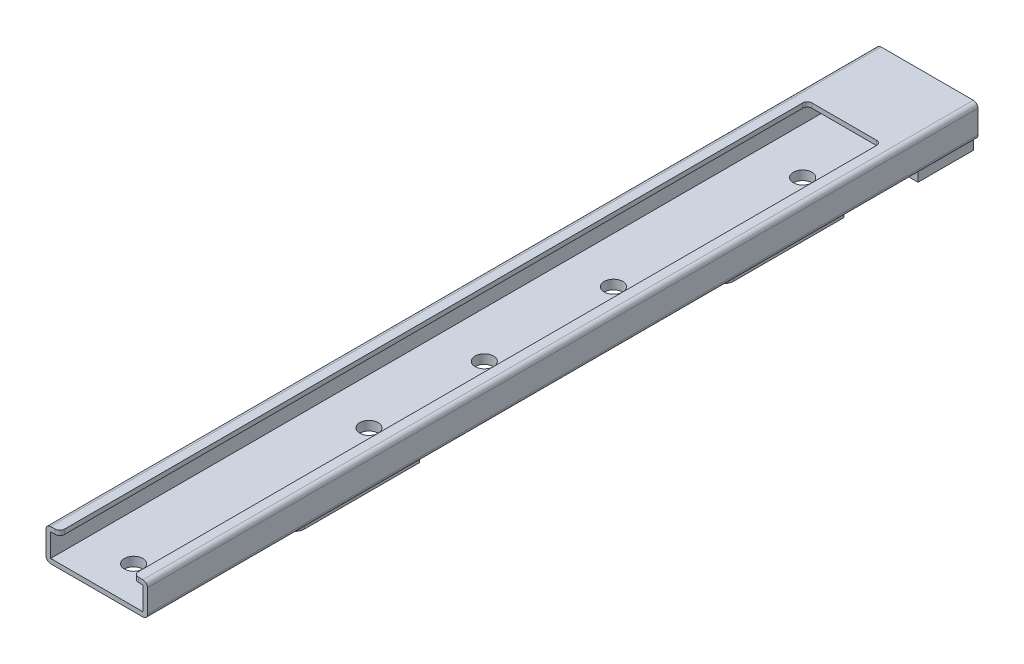
from build123d import *

# Parameters (mm, degrees)
SKETCH1_W           = 11
SKETCH1_H           = 90
BOSS_EXTRUDE1_DEPTH = 3.5
CUT_EXTRUDE1_DEPTH  = 81
CUT_EXTRUDE2_DEPTH  = 6
FILLET1_R           = 0.5
FILLET2_R           = 0.5
SKETCH4_R           = 2
SKETCH4_R_2         = 1
BOSS_EXTRUDE2_DEPTH = 0.5
CUT_EXTRUDE3_START  = -1
SKETCH4_2_R         = 1
CUT_EXTRUDE3_DEPTH  = 1
FILLET3_R           = 0.5
FILLET4_R           = 1
SKETCH5_W           = 10
SKETCH5_H           = 6
BOSS_EXTRUDE3_DEPTH = 1.2


with BuildPart() as part:
    # Sketch1 → Boss-Extrude1 (new body)
    with BuildSketch(Plane(origin=(0, 0, 0), x_dir=(1, 0, 0), z_dir=(0, 1, 0))):
        Rectangle(SKETCH1_W, SKETCH1_H)
    extrude(amount=BOSS_EXTRUDE1_DEPTH)

    # Sketch2 → Cut-Extrude1 (cut)
    with BuildSketch(Plane.XY.offset(45)):
        Polygon((-4, 3.5), (-4, 3), (-5, 3), (-5, 0.5), (5, 0.5), (5, 3), (4, 3), (4, 3.5), align=None)
    extrude(amount=-CUT_EXTRUDE1_DEPTH, mode=Mode.SUBTRACT)

    # Sketch3 → Cut-Extrude2 (cut)
    with BuildSketch(Plane.XY.offset(-36)):
        Polygon((-4, 3), (4, 3), (5, 3), (5, 0.5), (-5, 0.5), (-5, 3), align=None)
    extrude(amount=-CUT_EXTRUDE2_DEPTH, mode=Mode.SUBTRACT)

    # Fillet1
    fillet1_edges = [part.edges().sort_by_distance(p)[0] for p in [
        (-5.5, 3.5, 0),
        (5.5, 3.5, 0),
        (-5.5, 0, 0),
        (5.5, 0, 0),
    ]]
    fillet(fillet1_edges, radius=FILLET1_R)

    # Fillet2
    fillet2_edges = [part.edges().sort_by_distance(p)[0] for p in [
        (4, 3.25, -36),
        (-4, 3.25, -36),
        (-4, 3.25, 45),
        (4, 3.25, 45),
    ]]
    fillet(fillet2_edges, radius=FILLET2_R)

    # Sketch4 → Boss-Extrude2 (add)
    # profile 1 of 7: a face of its own
    with BuildSketch(Plane.XZ):
        with Locations(Location((0, -31.5, 0), (0, 0, 270))):
            Circle(SKETCH4_R)
        with Locations(Location((0, -31.5, 0), (0, 0, 270))):
            Circle(SKETCH4_R_2, mode=Mode.SUBTRACT)
    # profile 2 of 7: a face of its own
    with BuildSketch(Plane.XZ):
        with Locations(Location((0, -11, 0), (0, 0, 270))):
            Circle(SKETCH4_R)
        with Locations(Location((0, -11, 0), (0, 0, 270))):
            Circle(SKETCH4_R_2, mode=Mode.SUBTRACT)
    # profile 3 of 7: a face of its own
    with BuildSketch(Plane.XZ):
        with Locations(Location((0, 3, 0), (0, 0, 270))):
            Circle(SKETCH4_R)
        with Locations(Location((0, 3, 0), (0, 0, 270))):
            Circle(SKETCH4_R_2, mode=Mode.SUBTRACT)
    # profile 4 of 7: a face of its own
    with BuildSketch(Plane.XZ):
        with Locations(Location((0, 41, 0), (0, 0, 270))):
            Circle(SKETCH4_R)
        with Locations(Location((0, 41, 0), (0, 0, 270))):
            Circle(SKETCH4_R_2, mode=Mode.SUBTRACT)
    # profile 5 of 7: a face of its own
    with BuildSketch(Plane.XZ):
        with Locations(Location((0, 15.5, 0), (0, 0, 270))):
            Circle(SKETCH4_R)
        with Locations(Location((0, 15.5, 0), (0, 0, 270))):
            Circle(SKETCH4_R_2, mode=Mode.SUBTRACT)
    # profile 6 of 7: a face of its own
    with BuildSketch(Plane.XZ):
        Polygon((5, 28.5), (-5, 28.5), (-5, 15), (-3.5, 15), (-3.5, 18), (3.5, 18), (3.5, 15), (5, 15), align=None)
    # profile 7 of 7: a face of its own
    with BuildSketch(Plane.XZ):
        Polygon((5, -18), (-5, -18), (-5, -31), (-3.5, -31), (-3.5, -28), (3.5, -28), (3.5, -31), (5, -31), align=None)
    extrude(amount=BOSS_EXTRUDE2_DEPTH)

    # Sketch4<2> → Cut-Extrude3 (cut)
    with BuildSketch(Plane.XZ.offset(CUT_EXTRUDE3_START)):
        with Locations(Location((0, -31.5, 0), (0, 0, 270))):
            Circle(SKETCH4_2_R)
        with Locations(Location((0, -11, 0), (0, 0, 270))):
            Circle(SKETCH4_2_R)
        with Locations(Location((0, 3, 0), (0, 0, 270))):
            Circle(SKETCH4_2_R)
        with Locations(Location((0, 15.5, 0), (0, 0, 270))):
            Circle(SKETCH4_2_R)
        with Locations(Location((0, 41, 0), (0, 0, 270))):
            Circle(SKETCH4_2_R)
    extrude(amount=CUT_EXTRUDE3_DEPTH, mode=Mode.SUBTRACT)

    # Fillet3
    fillet3_edges = [part.edges().sort_by_distance(p)[0] for p in [
        (0, -0.5, -29.5),
        (0, -0.5, -9),
        (0, -0.5, 5),
        (0, -0.5, 17.5),
    ]]
    fillet(fillet3_edges, radius=FILLET3_R - 0.0001)  # a hair under: the kernel refuses the full size

    # Fillet4
    fillet4_edges = [part.edges().sort_by_distance(p)[0] for p in [
        (5, -0.25, 28.5),
        (-5, -0.25, 28.5),
        (5, -0.25, -18),
        (-5, -0.25, -18),
    ]]
    fillet(fillet4_edges, radius=FILLET4_R)

    # Sketch5 → Boss-Extrude3 (add)
    with BuildSketch(Plane.XZ):
        with Locations((0, -42)):
            Rectangle(SKETCH5_W, SKETCH5_H)
    extrude(amount=BOSS_EXTRUDE3_DEPTH)


solid = part.part
